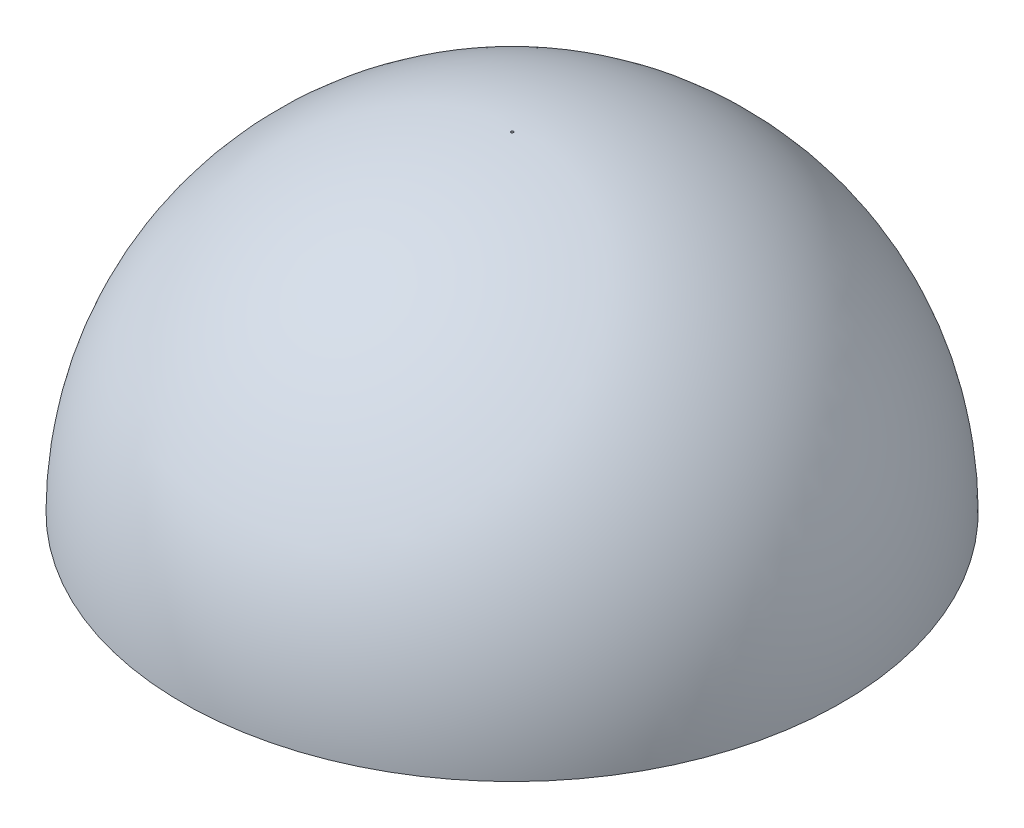
from build123d import *

# Parameters (mm, degrees)
SKETCH2_R          = 1.143
CUT_EXTRUDE1_DEPTH = 883.412


with BuildPart() as part:
    # Sketch1 → Revolve1 (revolve)
    with BuildSketch(Plane.XY):
        with BuildLine():
            ThreePointArc((-294.386, 0), (-208.162336886, 208.162336886), (0, 294.386))
            Line((0, 294.386), (0, 298.45))
            ThreePointArc((0, 298.45), (-211.036018845, 211.036018845), (-298.45, 0))
            Line((-298.45, 0), (-294.386, 0))
        make_face()
    revolve(axis=Axis((0, 0, 0), (0, 1, 0)))

    # Sketch2 → Cut-Extrude1 (cut)
    with BuildSketch(Plane(origin=(-482.931299771, -388.251536458, 69.199524142), x_dir=(0.519046968644619, 0, -0.854745719112317), z_dir=(0, 1, 0))):
        with Locations((309.812024235, -376.865657868)):
            Circle(SKETCH2_R)
    extrude(amount=CUT_EXTRUDE1_DEPTH, mode=Mode.SUBTRACT)


solid = part.part
